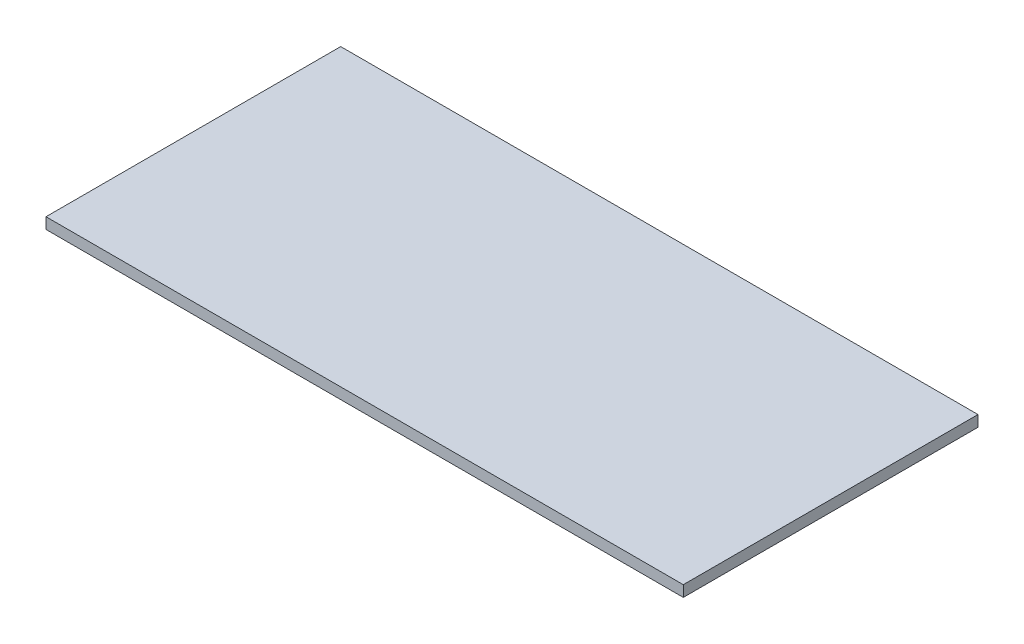
from build123d import *

# Parameters (mm, degrees)
SKETCH1_W           = 86.5
SKETCH1_H           = 40
BOSS_EXTRUDE1_DEPTH = 1.5


with BuildPart() as part:
    # Sketch1 → Boss-Extrude1 (new body)
    with BuildSketch(Plane(origin=(0, 0, 0), x_dir=(1, 0, 0), z_dir=(0, 1, 0))):
        with Locations((43.25, 20)):
            Rectangle(SKETCH1_W, SKETCH1_H)
    extrude(amount=BOSS_EXTRUDE1_DEPTH)


solid = part.part
